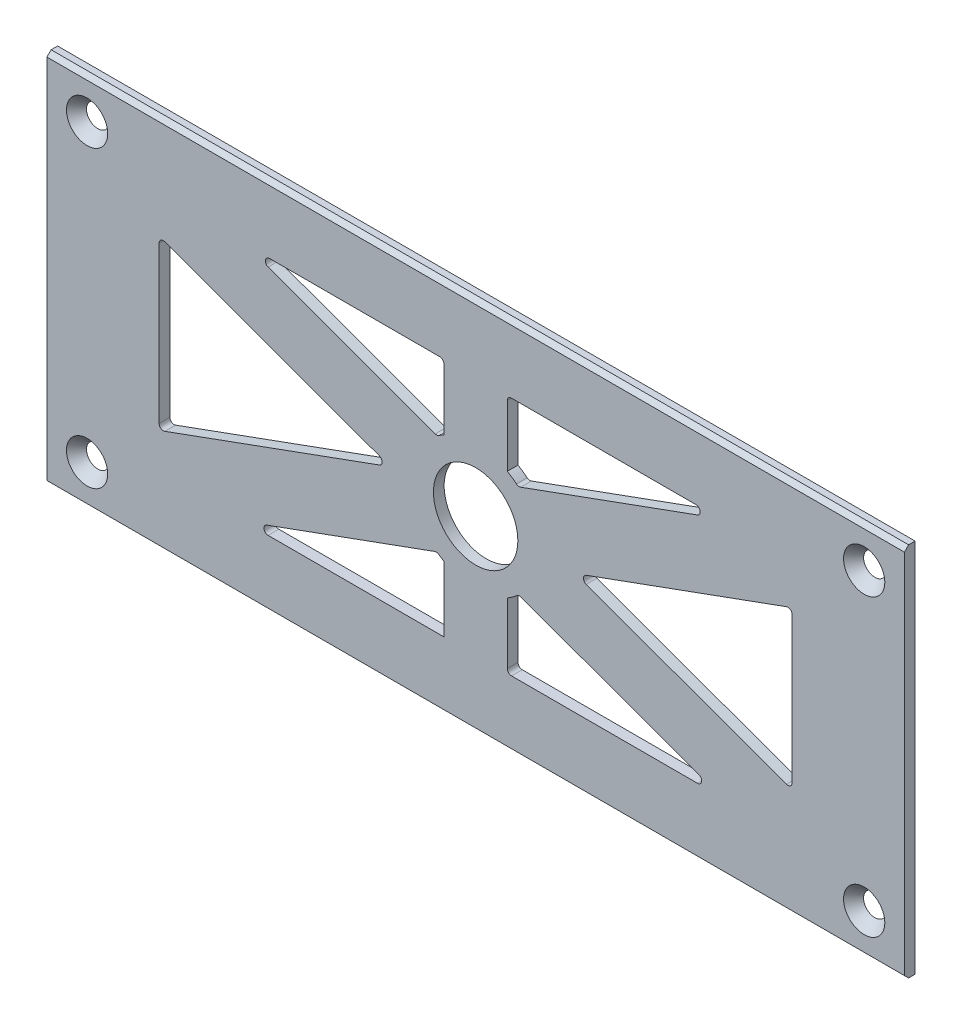
from build123d import *

# Parameters (mm, degrees)
SKETCH2_W                                    = 203.2
SKETCH2_H                                    = 88.9
SKETCH2_R                                    = 10
BOSS_EXTRUDE1_DEPTH                          = 1.27
SKETCH3_R                                    = 2.5527
CUT_EXTRUDE1_DEPTH                           = 111.92706658
CSK_FOR_10_OVAL_HEAD_MACHINE_SCREW1_AT_COUNT = 2
CSK_FOR_10_OVAL_HEAD_MACHINE_SCREW1_AT_PITCH = 69.85
CSK_FOR_10_OVAL_HEAD_MACHINE_SCREW1_2_COUNT  = 2
CSK_FOR_10_OVAL_HEAD_MACHINE_SCREW1_2_PITCH  = 196.952392725
CSK_FOR_10_OVAL_HEAD_MACHINE_SCREW1_3_COUNT  = 2
CSK_FOR_10_OVAL_HEAD_MACHINE_SCREW1_3_PITCH  = 184.15
CUT_EXTRUDE2_DEPTH                           = 10
FILLET1_R                                    = 1
CHAMFER1_SIZE                                = 1


with BuildPart() as part:
    # Sketch2 → Boss-Extrude1 (new, symmetric)
    with BuildSketch(Plane.XY):
        Rectangle(SKETCH2_W, SKETCH2_H)
        Circle(SKETCH2_R, mode=Mode.SUBTRACT)
    extrude(amount=BOSS_EXTRUDE1_DEPTH, both=True)

    # Sketch3 → Cut-Extrude1 (cut, through all)
    with BuildSketch(Plane.XY.offset(1.27)):
        with Locations((-92.075, 34.925)):
            Circle(SKETCH3_R)
        with Locations((-92.075, -34.925)):
            Circle(SKETCH3_R)
        with Locations((92.075, -34.925)):
            Circle(SKETCH3_R)
        with Locations((92.075, 34.925)):
            Circle(SKETCH3_R)
    extrude(amount=-CUT_EXTRUDE1_DEPTH, mode=Mode.SUBTRACT)

    # Sketch6 → CSK for #10 Oval Head Machine Screw1 (revolve, cut)
    with BuildSketch(Plane(origin=(-92.075, 34.925, 1.27), x_dir=(0, -1, 0), z_dir=(1, 0, 0))):
        Polygon((0, 0), (0, 2.54), (2.5527, 2.54), (2.5527, 2.688180894), (4.8895, 0), align=None)
    csk_for_10_oval_head_machine_screw1 = revolve(axis=Axis((-92.075, 34.925, 7.62), (0, 0, -1)), mode=Mode.SUBTRACT)

    # CSK for #10 Oval Head Machine Screw1 at: CSK for #10 Oval Head Machine Screw1 ×2
    with Locations(*[(0, -i * CSK_FOR_10_OVAL_HEAD_MACHINE_SCREW1_AT_PITCH, 0) for i in range(1, CSK_FOR_10_OVAL_HEAD_MACHINE_SCREW1_AT_COUNT)]):
        add(csk_for_10_oval_head_machine_screw1, mode=Mode.SUBTRACT)

    # CSK for _10 Oval Head Machine Screw1 2: CSK for #10 Oval Head Machine Screw1 ×2
    with Locations(*[Vector(0.9349975263177835, -0.35465423412053854, 0) * (i * CSK_FOR_10_OVAL_HEAD_MACHINE_SCREW1_2_PITCH) for i in range(1, CSK_FOR_10_OVAL_HEAD_MACHINE_SCREW1_2_COUNT)]):
        add(csk_for_10_oval_head_machine_screw1, mode=Mode.SUBTRACT)

    # CSK for _10 Oval Head Machine Screw1 3: CSK for #10 Oval Head Machine Screw1 ×2
    with Locations(*[(i * CSK_FOR_10_OVAL_HEAD_MACHINE_SCREW1_3_PITCH, 0, 0) for i in range(1, CSK_FOR_10_OVAL_HEAD_MACHINE_SCREW1_3_COUNT)]):
        add(csk_for_10_oval_head_machine_screw1, mode=Mode.SUBTRACT)

    # Sketch8 → Cut-Extrude2 (cut)
    with BuildSketch(Plane.XY.offset(1.27)):
        with BuildLine():
            ThreePointArc((-9.056963652, 11.957065251), (-8.2945884, 12.49799197), (-7.5, 12.990381057))
            Line((-7.5, 12.990381057), (-7.5, 28.5))
            Line((-7.5, 28.5), (-54.508303326, 28.5))
            Line((-54.508303326, 28.5), (-9.056963652, 11.957065251))
        make_face()
        with BuildLine():
            Line((7.5, 28.5), (7.5, 12.990381057))
            ThreePointArc((7.5, 12.990381057), (8.845524205, 12.114318039), (10.089701433, 11.099456067))
            Line((10.089701433, 11.099456067), (57.897302974, 28.5))
            Line((57.897302974, 28.5), (7.5, 28.5))
        make_face()
        Polygon((-75, -19.870662497), (-20.234033177, 0.062519277), (-75, 19.995701052), align=None)
        Polygon((75, 18.762206056), (23.623032825, 0.062519277), (75, -18.637167501), align=None)
        with BuildLine():
            ThreePointArc((-7.5, -12.990381057), (-8.352596776, -12.459298821), (-9.167737924, -11.872345234))
            Line((-9.167737924, -11.872345234), (-54.851843932, -28.5))
            Line((-54.851843932, -28.5), (-7.5, -28.5))
            Line((-7.5, -28.5), (-7.5, -12.990381057))
        make_face()
        with BuildLine():
            Line((58.24084358, -28.5), (10.187304551, -11.009942142))
            ThreePointArc((10.187304551, -11.009942142), (8.898916796, -12.075151339), (7.5, -12.990381057))
            Line((7.5, -12.990381057), (7.5, -28.5))
            Line((7.5, -28.5), (58.24084358, -28.5))
        make_face()
    extrude(amount=-CUT_EXTRUDE2_DEPTH, mode=Mode.SUBTRACT)

    # Fillet1
    fillet1_edges = [part.edges().sort_by_distance(p)[0] for p in [
        (-54.851843932, -28.5, 0),
        (7.5, -28.5, 0),
        (-9.167737924, -11.872345234, 0),
        (10.187304551, -11.009942142, 0),
        (58.24084358, -28.5, 0),
        (75, -18.637167501, 0),
        (75, 18.762206056, 0),
        (23.623032825, 0.062519277, 0),
        (57.897302974, 28.5, 0),
        (7.5, 28.5, 0),
        (10.089701433, 11.099456067, 0),
        (-54.508303326, 28.5, 0),
        (-7.5, 28.5, 0),
        (-9.056963652, 11.957065251, 0),
        (-20.234033177, 0.062519277, 0),
        (-75, -19.870662497, 0),
        (-75, 19.995701052, 0),
    ]]
    fillet(fillet1_edges, radius=FILLET1_R)

    # Chamfer1
    chamfer1_edges = [part.edges().sort_by_distance(p)[0] for p in [
        (0, -44.45, 1.27),
        (0, 44.45, 1.27),
    ]]
    chamfer(chamfer1_edges, length=CHAMFER1_SIZE)


solid = part.part
